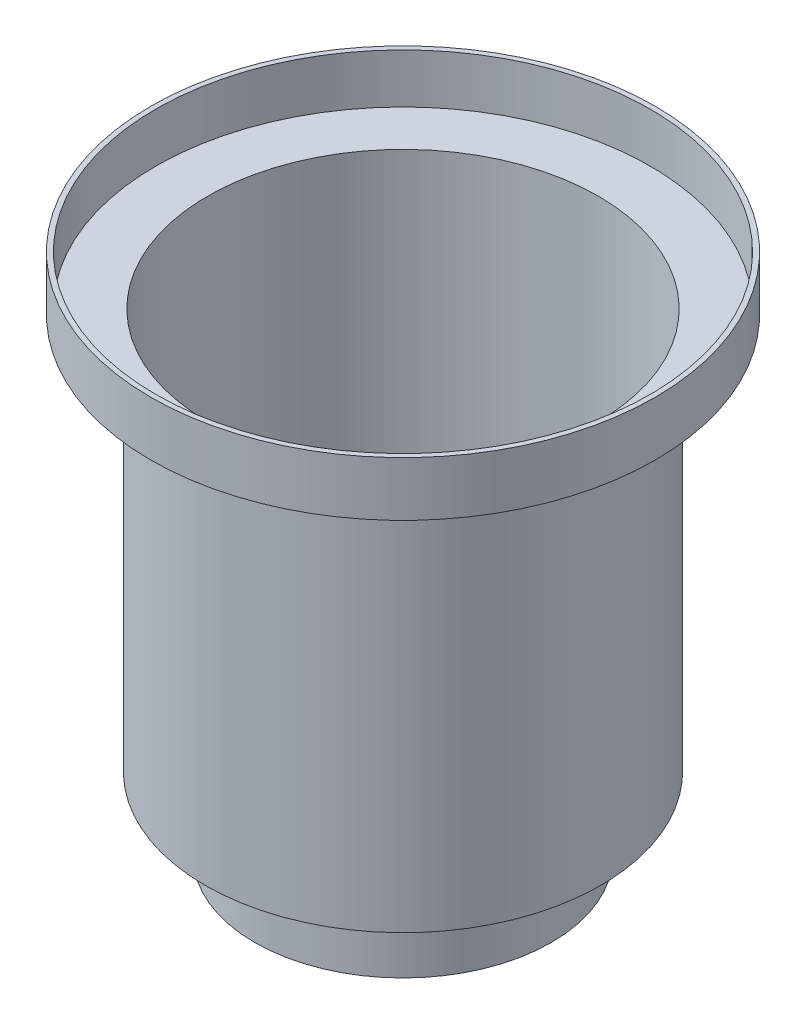
from build123d import *

# Parameters (mm, degrees)
SKETCH1_R           = 5.1
SKETCH1_R_2         = 5
SKETCH8_R           = 5.1
BOSS_EXTRUDE2_DEPTH = 0.1
SKETCH9_R           = 4
BOSS_EXTRUDE3_DEPTH = 8
SKETCH10_R          = 3.95
CUT_EXTRUDE1_DEPTH  = 11.84573649
SKETCH12_4_R        = 3
SKETCH12_4_R_2      = 2.9
EXTRUDE_THIN2_DEPTH = 1


# Read off the part's stored shape, not the designer's step: Loft-Thin7
with BuildPart() as part:
    # Sweep-Thin1: sweep along a path in Sketch3
    with BuildLine(Plane(origin=(0, 0, 0), x_dir=(0, 0, -1), z_dir=(1, 0, 0))) as sweep_thin1_path:
        Line((0, 0), (0, 1))
    # Sketch1 → Sweep-Thin1 (sweep)
    with BuildSketch(Plane(origin=(0, 0, 0), x_dir=(1, 0, 0), z_dir=(0, 1, 0))):
        Circle(SKETCH1_R)
        Circle(SKETCH1_R_2, mode=Mode.SUBTRACT)
    sweep(path=sweep_thin1_path.line)

    # Sketch8 → Boss-Extrude2 (add)
    with BuildSketch(Plane(origin=(0, 0, 0), x_dir=(-1, 0, 0), z_dir=(0, -1, 0))):
        with Locations(Location((0, 0, 0), (0, 0, 270))):
            Circle(SKETCH8_R)
    extrude(amount=BOSS_EXTRUDE2_DEPTH)

    # Sketch9 → Boss-Extrude3 (add)
    with BuildSketch(Plane(origin=(0, -0.1, 0), x_dir=(-1, 0, 0), z_dir=(0, -1, 0))):
        with Locations(Location((0, 0, 0), (0, 0, 90))):
            Circle(SKETCH9_R)
    extrude(amount=BOSS_EXTRUDE3_DEPTH)

    # Sketch10 → Cut-Extrude1 (cut, through all)
    with BuildSketch(Plane(origin=(0, 0, 0), x_dir=(1, 0, 0), z_dir=(0, 1, 0))):
        with Locations(Location((0, 0, 0), (0, 0, 270))):
            Circle(SKETCH10_R)
    extrude(amount=-CUT_EXTRUDE1_DEPTH, mode=Mode.SUBTRACT)

    # Loft-Thin7 outline → Loft-Thin7 (revolve)
    with BuildSketch(Plane.XY):
        Polygon((4, -8.1), (3.776393202, -8.1), (2.776393202, -8.6), (3, -8.6), align=None)
    revolve(axis=Axis((0, 0, 0), (0, 1, 0)))

    # Sketch12<4> → Extrude-Thin2 (add)
    with BuildSketch(Plane(origin=(0, -8.6, 0), x_dir=(-1, 0, 0), z_dir=(0, -1, 0))):
        Circle(SKETCH12_4_R)
        Circle(SKETCH12_4_R_2, mode=Mode.SUBTRACT)
    extrude(amount=EXTRUDE_THIN2_DEPTH)

    # Sketch16 → Revolve-Thin2 (revolve)
    with BuildSketch(Plane.XY, mode=Mode.PRIVATE) as revolve_thin2_sk:
        Polygon((0, -9.6), (0, -10.1), (3, -9.6), align=None)
        Polygon((0.1, -9.7), (0.1, -9.981953958), (1.791723747, -9.7), align=None, mode=Mode.SUBTRACT)
    revolve(revolve_thin2_sk.sketch.rotate(Axis((0, -16.369174854, 0), (0, 1, 0)), 270), axis=Axis((0, -16.369174854, 0), (0, 1, 0)))


solid = part.part
